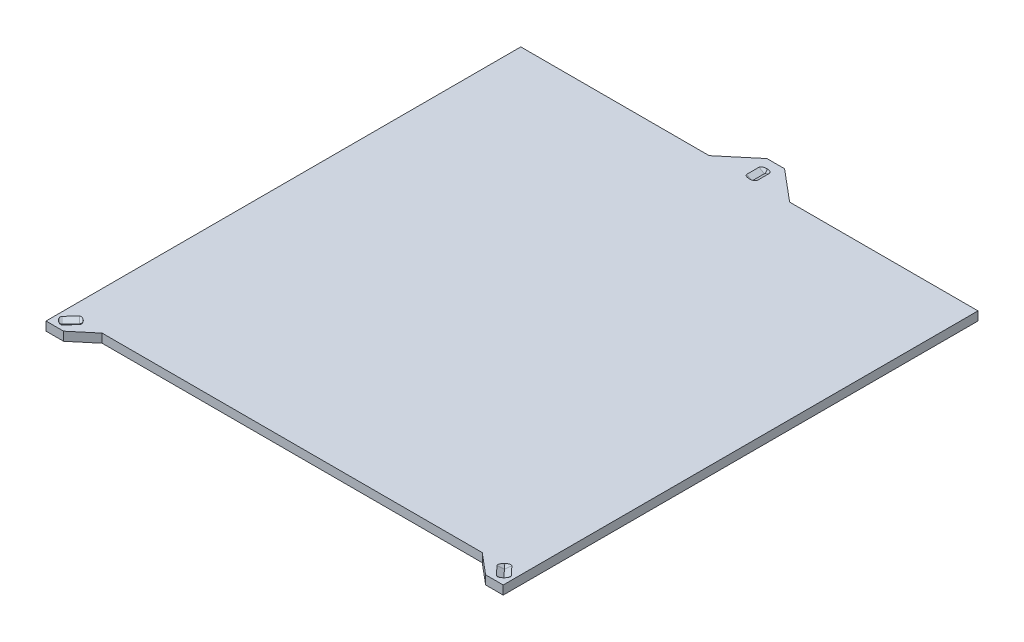
from build123d import *

# Parameters (mm, degrees)
BOSS_EXTRUDE1_DEPTH  = 10
CUT_EXTRUDE1_DEPTH   = 20
FILLET1_R            = 3
FILLET1_OF_MIRROR1_R = 3
CUT_EXTRUDE2_DEPTH   = 20
FILLET2_R            = 3
SKETCH7_R            = 6.25
CUT_EXTRUDE3_DEPTH   = 5.5


with BuildPart() as part:
    # Sketch1 → Boss-Extrude1 (new body)
    with BuildSketch(Plane(origin=(0, 0, 0), x_dir=(1, 0, 0), z_dir=(0, 1, 0))):
        Polygon((-260, -260), (-260, -280), (-240, -280), (-216.164928148, -260), (216.164928148, -260), (240, -280), (260, -280), (260, -260), (260, 260), (45.752607778, 260), (10, 290), (-10, 290), (-45.752607778, 260), (-260, 260), align=None)
    extrude(amount=BOSS_EXTRUDE1_DEPTH)

    # Sketch5 → Cut-Extrude1 (cut)
    with BuildSketch(Plane(origin=(-253.195489006, 0, 272.672065084), x_dir=(0, -1, 0), z_dir=(0.6804510993672804, 0, -0.7327934916262968))):
        Polygon((-10, 6), (-10, -6), (-6.535898385, 0), align=None)
    cut_extrude1 = extrude(amount=CUT_EXTRUDE1_DEPTH, mode=Mode.SUBTRACT)

    # Fillet1
    fillet1_edges = [part.edges().sort_by_distance(p)[0] for p in [
        (-241.784847494, 8.267949192, 255.974841953),
        (-237.388086544, 8.267949192, 260.057548549),
        (-250.997108531, 8.267949192, 274.713418382),
        (-255.393869481, 8.267949192, 270.630711786),
    ]]
    fillet(fillet1_edges, radius=FILLET1_R - 0.0001)  # a hair under: the kernel refuses the full size

    # Mirror1: Cut-Extrude1 across plane
    add(cut_extrude1.mirror(Plane(origin=(0, 0, 0), x_dir=(0, 0, 1), z_dir=(1, 0, 0))), mode=Mode.SUBTRACT)

    # Fillet1 of Mirror1
    fillet1_of_mirror1_edges = [part.edges().sort_by_distance(p)[0] for p in [
        (241.784847494, 8.267949192, 255.974841953),
        (237.388086544, 8.267949192, 260.057548549),
        (250.997108531, 8.267949192, 274.713418382),
        (255.393869481, 8.267949192, 270.630711786),
    ]]
    fillet(fillet1_of_mirror1_edges, radius=FILLET1_OF_MIRROR1_R - 0.0001)  # a hair under: the kernel refuses the full size

    # Sketch6 → Cut-Extrude2 (cut)
    with BuildSketch(Plane(origin=(0, 0, -280), x_dir=(-1, 0, 0), z_dir=(0, 0, -1))):
        Polygon((-6, 10), (6, 10), (0, 6.535898385), align=None)
    extrude(amount=-CUT_EXTRUDE2_DEPTH, mode=Mode.SUBTRACT)

    # Fillet2
    fillet2_edges = [part.edges().sort_by_distance(p)[0] for p in [
        (3, 8.267949192, -260),
        (-3, 8.267949192, -260),
        (3, 8.267949192, -280),
        (-3, 8.267949192, -280),
    ]]
    fillet(fillet2_edges, radius=FILLET2_R - 0.0001)  # a hair under: the kernel refuses the full size

    # Sketch7 → Cut-Extrude3 (cut)
    with BuildSketch(Plane.XZ):
        with Locations(Location((-246.390978013, 265.344130167, 0), (0, 0, 270))):
            Circle(SKETCH7_R)
        with Locations(Location((246.390978013, 265.344130167, 0), (0, 0, 270))):
            Circle(SKETCH7_R)
        with Locations(Location((0, -270, 0), (0, 0, 270))):
            Circle(SKETCH7_R)
    extrude(amount=-CUT_EXTRUDE3_DEPTH, mode=Mode.SUBTRACT)


solid = part.part
